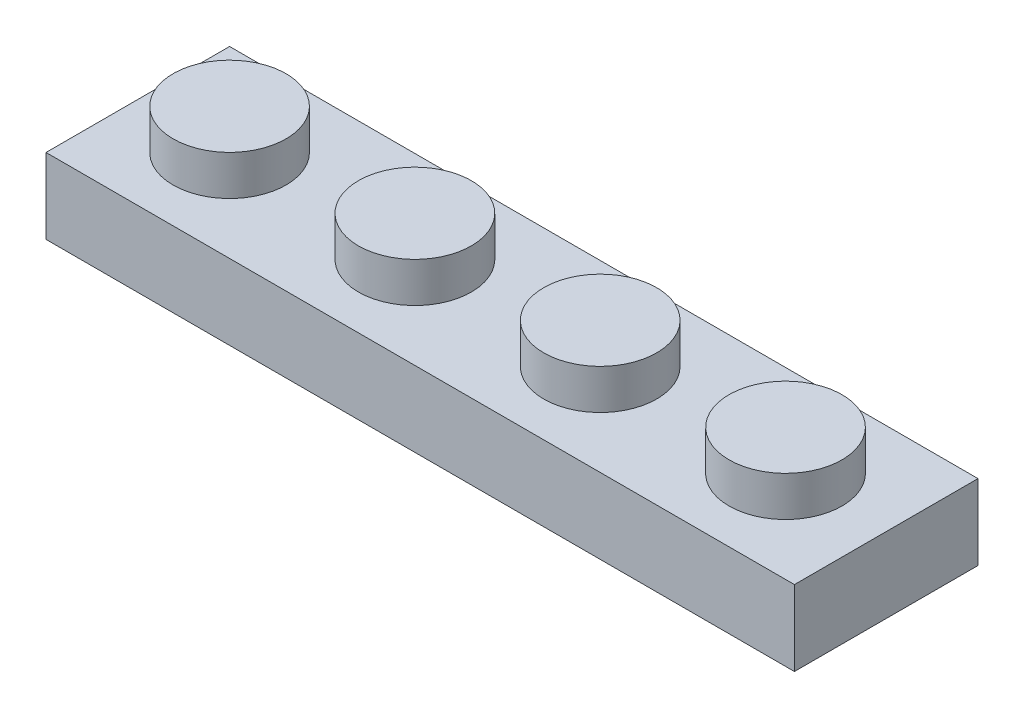
from build123d import *

# Parameters (mm, degrees)
SKETCH_1_W          = 31.8
SKETCH_1_H          = 7.8
EXTRUDE_1_DEPTH     = 3.2
SKETCH_2_R          = 2.4
EXTRUDE_2_DEPTH     = 1.7
SKETCH_3_R          = 2.5
CUT_EXTRUDE_1_DEPTH = 1.8


with BuildPart() as part:
    # Эскиз1 → Бобышка-Вытянуть1 (new body)
    with BuildSketch(Plane(origin=(0, 0, 0), x_dir=(1, 0, 0), z_dir=(0, 1, 0))):
        Rectangle(SKETCH_1_W, SKETCH_1_H)
    extrude(amount=EXTRUDE_1_DEPTH)

    # Эскиз2 → Бобышка-Вытянуть2 (add)
    with BuildSketch(Plane(origin=(0, 3.2, 0), x_dir=(1, 0, 0), z_dir=(0, 1, 0))):
        with Locations((-12, 0)):
            Circle(SKETCH_2_R)
        with Locations((-4.126, 0)):
            Circle(SKETCH_2_R)
        with Locations((3.748, 0)):
            Circle(SKETCH_2_R)
        with Locations((11.622, 0)):
            Circle(SKETCH_2_R)
    extrude(amount=EXTRUDE_2_DEPTH)

    # Эскиз3 → Вырез-Вытянуть1 (cut)
    with BuildSketch(Plane.XZ):
        with Locations((-12, 0)):
            Circle(SKETCH_3_R)
        with Locations((-4.126, 0)):
            Circle(SKETCH_3_R)
        with Locations((3.748, 0)):
            Circle(SKETCH_3_R)
        with Locations((11.622, 0)):
            Circle(SKETCH_3_R)
    extrude(amount=-CUT_EXTRUDE_1_DEPTH, mode=Mode.SUBTRACT)


solid = part.part
